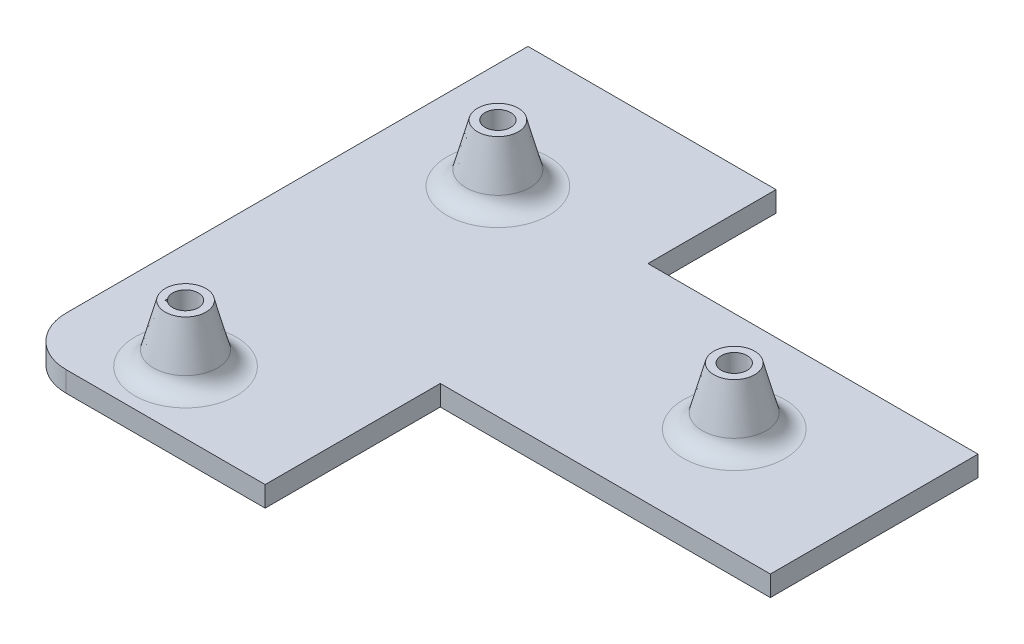
from build123d import *

# Parameters (mm, degrees)
BACKPLANE_EXTRUDE_DEPTH = 3.175
BACKPLANE_FILLETS_R     = 7.62
PROTOBOARD1_R           = 5.5499
PROTOBOARD1_R_2         = 1.9939
BOSS_EXTRUDE2_DEPTH     = 8.89
DRAFT1_ANGLE            = 15
FILLET5_R               = 3.048
PROTOBOARD2_R           = 5.5499
PROTOBOARD2_R_2         = 1.9939
BOSS_EXTRUDE3_DEPTH     = 8.89
DRAFT2_ANGLE            = 15
FILLET6_R               = 3.048
ADS1256_R               = 5.5499
ADS1256_R_2             = 1.9939
BOSS_EXTRUDE4_DEPTH     = 8.89
DRAFT3_ANGLE            = 15
FILLET7_R               = 3.048
F_3V_BUCK_R             = 5.5499
F_3V_BUCK_R_2           = 1.9939
BOSS_EXTRUDE5_DEPTH     = 8.89
DRAFT4_ANGLE            = 15
FILLET8_R               = 3.048
RELAY_R                 = 5.5499
RELAY_R_2               = 1.9939
BOSS_EXTRUDE6_DEPTH     = 8.89
DRAFT5_ANGLE            = 15
FILLET9_R               = 3.048
SERVOBOARD_R            = 5.5499
SERVOBOARD_R_2          = 1.9939
BOSS_EXTRUDE7_DEPTH     = 8.89
DRAFT6_ANGLE            = 15
FILLET10_R              = 3.048
NUCLEO_R                = 5.5499
NUCLEO_R_2              = 1.9939
BOSS_EXTRUDE8_DEPTH     = 8.89
DRAFT7_ANGLE            = 15
FILLET11_R              = 3.048
SKETCH1_OUTSIDE_W       = 276.132
SKETCH1_OUTSIDE_H       = 290.102
SKETCH1_OUTSIDE_W_2     = 99.897700443
SKETCH1_OUTSIDE_H_2     = 83.556409937
CUT_EXTRUDE1_DEPTH      = 9.525
SKETCH2_W               = 61.487179275
SKETCH2_H               = 33.59203724
SKETCH2_H_2             = 38.503153795
CUT_EXTRUDE2_DEPTH      = 9.525


with BuildPart() as part:
    # Backplane → Backplane_Extrude (new body)
    with BuildSketch(Plane(origin=(0, 0, 0), x_dir=(1, 0, 0), z_dir=(0, 1, 0))):
        Polygon((8.255, 87.63), (-80.645, 87.63), (-106.045, 87.63), (-106.045, -113.03), (106.045, -113.03), (106.045, 87.63), (80.645, 87.63), (80.645, 113.03), (8.255, 113.03), align=None)
    extrude(amount=-BACKPLANE_EXTRUDE_DEPTH)

    # Backplane_Fillets
    backplane_fillets_edges = [part.edges().sort_by_distance(p)[0] for p in [
        (106.045, -1.5875, -87.63),
        (80.645, -1.5875, -87.63),
        (80.645, -1.5875, -113.03),
        (-106.045, -1.5875, -87.63),
        (106.045, -1.5875, 113.03),
        (-106.045, -1.5875, 113.03),
        (8.255, -1.5875, -113.03),
        (8.255, -1.5875, -87.63),
    ]]
    fillet(backplane_fillets_edges, radius=BACKPLANE_FILLETS_R)

    # Protoboard1 → Boss-Extrude2 (add)
    # profile 1 of 2: a face of its own
    with BuildSketch(Plane(origin=(0, 0, 0), x_dir=(1, 0, 0), z_dir=(0, 1, 0))):
        with Locations((-94.477155088, 49.182704314)):
            Circle(PROTOBOARD1_R)
        with Locations((-94.477155088, 49.182704314)):
            Circle(PROTOBOARD1_R_2, mode=Mode.SUBTRACT)
    # profile 2 of 2: a face of its own
    with BuildSketch(Plane(origin=(0, 0, 0), x_dir=(1, 0, 0), z_dir=(0, 1, 0))):
        with Locations((55.560644912, 49.182704314)):
            Circle(PROTOBOARD1_R)
        with Locations((55.560644912, 49.182704314)):
            Circle(PROTOBOARD1_R_2, mode=Mode.SUBTRACT)
    extrude(amount=BOSS_EXTRUDE2_DEPTH)

    # Draft1
    draft1_faces = [part.faces().sort_by_distance(p)[0] for p in [
        (50.010744912, 4.445, -49.182704314),
        (-100.027055088, 4.445, -49.182704314),
    ]]
    draft(draft1_faces, Plane.ZX, DRAFT1_ANGLE)

    # Fillet5
    fillet5_edges = [part.edges().sort_by_distance(p)[0] for p in [
        (50.010744912, 0, -49.182704314),
        (-100.027055088, 0, -49.182704314),
    ]]
    fillet(fillet5_edges, radius=FILLET5_R)

    # Protoboard2 → Boss-Extrude3 (add)
    # profile 1 of 2: a face of its own
    with BuildSketch(Plane(origin=(0, 0, 0), x_dir=(1, 0, 0), z_dir=(0, 1, 0))):
        with Locations((-95.3389, -8.255)):
            Circle(PROTOBOARD2_R)
        with Locations((-95.3389, -8.255)):
            Circle(PROTOBOARD2_R_2, mode=Mode.SUBTRACT)
    # profile 2 of 2: a face of its own
    with BuildSketch(Plane(origin=(0, 0, 0), x_dir=(1, 0, 0), z_dir=(0, 1, 0))):
        with Locations((54.6989, -8.255)):
            Circle(PROTOBOARD2_R)
        with Locations((54.6989, -8.255)):
            Circle(PROTOBOARD2_R_2, mode=Mode.SUBTRACT)
    extrude(amount=BOSS_EXTRUDE3_DEPTH)

    # Draft2
    draft2_faces = [part.faces().sort_by_distance(p)[0] for p in [
        (49.149, 4.445, 8.255),
        (-100.8888, 4.445, 8.255),
    ]]
    draft(draft2_faces, Plane.ZX, DRAFT2_ANGLE)

    # Fillet6
    fillet6_edges = [part.edges().sort_by_distance(p)[0] for p in [
        (49.149, 0, 8.255),
        (-100.8888, 0, 8.255),
    ]]
    fillet(fillet6_edges, radius=FILLET6_R)

    # ADS1256 → Boss-Extrude4 (add)
    # profile 1 of 4: a face of its own
    with BuildSketch(Plane(origin=(0, 0, 0), x_dir=(1, 0, 0), z_dir=(0, 1, 0))):
        with Locations((68.129687485, -33.451693835)):
            Circle(ADS1256_R)
        with Locations((68.129687485, -33.451693835)):
            Circle(ADS1256_R_2, mode=Mode.SUBTRACT)
    # profile 2 of 4: a face of its own
    with BuildSketch(Plane(origin=(0, 0, 0), x_dir=(1, 0, 0), z_dir=(0, 1, 0))):
        with Locations((98.609687485, -33.451693835)):
            Circle(ADS1256_R)
        with Locations((98.609687485, -33.451693835)):
            Circle(ADS1256_R_2, mode=Mode.SUBTRACT)
    # profile 3 of 4: a face of its own
    with BuildSketch(Plane(origin=(0, 0, 0), x_dir=(1, 0, 0), z_dir=(0, 1, 0))):
        with Locations((68.129687485, 22.174306165)):
            Circle(ADS1256_R)
        with Locations((68.129687485, 22.174306165)):
            Circle(ADS1256_R_2, mode=Mode.SUBTRACT)
    # profile 4 of 4: a face of its own
    with BuildSketch(Plane(origin=(0, 0, 0), x_dir=(1, 0, 0), z_dir=(0, 1, 0))):
        with Locations((98.609687485, 22.174306165)):
            Circle(ADS1256_R)
        with Locations((98.609687485, 22.174306165)):
            Circle(ADS1256_R_2, mode=Mode.SUBTRACT)
    extrude(amount=BOSS_EXTRUDE4_DEPTH)

    # Draft3
    draft3_faces = [part.faces().sort_by_distance(p)[0] for p in [
        (93.059787485, 4.445, -22.174306165),
        (93.059787485, 4.445, 33.451693835),
        (62.579787485, 4.445, 33.451693835),
        (62.579787485, 4.445, -22.174306165),
    ]]
    draft(draft3_faces, Plane.ZX, DRAFT3_ANGLE)

    # Fillet7
    fillet7_edges = [part.edges().sort_by_distance(p)[0] for p in [
        (93.059787485, 0, 33.451693835),
        (93.059787485, 0, -22.174306165),
        (62.579787485, 0, -22.174306165),
        (62.579787485, 0, 33.451693835),
    ]]
    fillet(fillet7_edges, radius=FILLET7_R)

    # 3V_Buck → Boss-Extrude5 (add)
    with BuildSketch(Plane(origin=(0, 0, 0), x_dir=(1, 0, 0), z_dir=(0, 1, 0))):
        with Locations((88.21146798, 54.766566069)):
            Circle(F_3V_BUCK_R)
        with Locations((88.21146798, 54.766566069)):
            Circle(F_3V_BUCK_R_2, mode=Mode.SUBTRACT)
    extrude(amount=BOSS_EXTRUDE5_DEPTH)

    # Draft4
    draft4_faces = [part.faces().sort_by_distance(p)[0] for p in [
        (82.66156798, 4.445, -54.766566069),
    ]]
    draft(draft4_faces, Plane.ZX, DRAFT4_ANGLE)

    # Fillet8
    fillet8_edges = [part.edges().sort_by_distance(p)[0] for p in [
        (82.66156798, 0, -54.766566069),
    ]]
    fillet(fillet8_edges, radius=FILLET8_R)

    # Relay → Boss-Extrude6 (add)
    # profile 1 of 4: a face of its own
    with BuildSketch(Plane(origin=(0, 0, 0), x_dir=(1, 0, 0), z_dir=(0, 1, 0))):
        with Locations((19.216535219, 84.199904102)):
            Circle(RELAY_R)
        with Locations((19.216535219, 84.199904102)):
            Circle(RELAY_R_2, mode=Mode.SUBTRACT)
    # profile 2 of 4: a face of its own
    with BuildSketch(Plane(origin=(0, 0, 0), x_dir=(1, 0, 0), z_dir=(0, 1, 0))):
        with Locations((63.717335219, 84.199904102)):
            Circle(RELAY_R)
        with Locations((63.717335219, 84.199904102)):
            Circle(RELAY_R_2, mode=Mode.SUBTRACT)
    # profile 3 of 4: a face of its own
    with BuildSketch(Plane(origin=(0, 0, 0), x_dir=(1, 0, 0), z_dir=(0, 1, 0))):
        with Locations((19.216535219, 105.789904102)):
            Circle(RELAY_R)
        with Locations((19.216535219, 105.789904102)):
            Circle(RELAY_R_2, mode=Mode.SUBTRACT)
    # profile 4 of 4: a face of its own
    with BuildSketch(Plane(origin=(0, 0, 0), x_dir=(1, 0, 0), z_dir=(0, 1, 0))):
        with Locations((63.717335219, 105.789904102)):
            Circle(RELAY_R)
        with Locations((63.717335219, 105.789904102)):
            Circle(RELAY_R_2, mode=Mode.SUBTRACT)
    extrude(amount=BOSS_EXTRUDE6_DEPTH)

    # Draft5
    draft5_faces = [part.faces().sort_by_distance(p)[0] for p in [
        (13.666635219, 4.445, -84.199904102),
        (58.167435219, 4.445, -84.199904102),
        (58.167435219, 4.445, -105.789904102),
        (13.666635219, 4.445, -105.789904102),
    ]]
    draft(draft5_faces, Plane.ZX, DRAFT5_ANGLE)

    # Fillet9
    fillet9_edges = [part.edges().sort_by_distance(p)[0] for p in [
        (13.666635219, 0, -84.199904102),
        (58.167435219, 0, -84.199904102),
        (58.167435219, 0, -105.789904102),
        (13.666635219, 0, -105.789904102),
    ]]
    fillet(fillet9_edges, radius=FILLET9_R)

    # ServoBoard → Boss-Extrude7 (add)
    # profile 1 of 3: a face of its own
    with BuildSketch(Plane(origin=(0, 0, 0), x_dir=(1, 0, 0), z_dir=(0, 1, 0))):
        with Locations((-89.601054156, -103.3389565)):
            Circle(SERVOBOARD_R)
        with BuildLine():
            ThreePointArc((-91.188554156, -104.545389657), (-88.191153945, -101.929056289), (-90.807487312, -104.9264565))
            Line((-90.807487312, -104.9264565), (-91.188554156, -104.9264565))
            Line((-91.188554156, -104.9264565), (-91.188554156, -104.545389657))
        make_face(mode=Mode.SUBTRACT)
    # profile 2 of 3: a face of its own
    with BuildSketch(Plane(origin=(0, 0, 0), x_dir=(1, 0, 0), z_dir=(0, 1, 0))):
        with Locations((-89.601054156, -54.8757565)):
            Circle(SERVOBOARD_R)
        with Locations((-89.601054156, -54.8757565)):
            Circle(SERVOBOARD_R_2, mode=Mode.SUBTRACT)
    # profile 3 of 3: a face of its own
    with BuildSketch(Plane(origin=(0, 0, 0), x_dir=(1, 0, 0), z_dir=(0, 1, 0))):
        with Locations((-38.613679755, -69.190417722)):
            Circle(SERVOBOARD_R)
        with Locations((-38.613679755, -69.190417722)):
            Circle(SERVOBOARD_R_2, mode=Mode.SUBTRACT)
    extrude(amount=BOSS_EXTRUDE7_DEPTH)

    # Draft6
    draft6_faces = [part.faces().sort_by_distance(p)[0] for p in [
        (-95.150954156, 4.445, 54.8757565),
        (-44.163579755, 4.445, 69.190417722),
        (-95.150954156, 4.445, 103.3389565),
    ]]
    draft(draft6_faces, Plane.ZX, DRAFT6_ANGLE)

    # Fillet10
    fillet10_edges = [part.edges().sort_by_distance(p)[0] for p in [
        (-95.150954156, 0, 103.3389565),
        (-44.163579755, 0, 69.190417722),
        (-95.150954156, 0, 54.8757565),
    ]]
    fillet(fillet10_edges, radius=FILLET10_R)

    # Nucleo → Boss-Extrude8 (add)
    # profile 1 of 4: a face of its own
    with BuildSketch(Plane(origin=(0, 0, 0), x_dir=(1, 0, 0), z_dir=(0, 1, 0))):
        with Locations((73.719801758, -98.03908452)):
            Circle(NUCLEO_R)
        with BuildLine():
            Line((75.307301758, -99.245517676), (75.307301758, -99.62658452))
            Line((75.307301758, -99.62658452), (74.926234914, -99.62658452))
            ThreePointArc((74.926234914, -99.62658452), (72.309901547, -96.629184309), (75.307301758, -99.245517676))
        make_face(mode=Mode.SUBTRACT)
    # profile 2 of 4: a face of its own
    with BuildSketch(Plane(origin=(0, 0, 0), x_dir=(1, 0, 0), z_dir=(0, 1, 0))):
        with Locations((73.719801758, -49.77908452)):
            Circle(NUCLEO_R)
        with Locations((73.719801758, -49.77908452)):
            Circle(NUCLEO_R_2, mode=Mode.SUBTRACT)
    # profile 3 of 4: a face of its own
    with BuildSketch(Plane(origin=(0, 0, 0), x_dir=(1, 0, 0), z_dir=(0, 1, 0))):
        with Locations((-1.270198122, -51.04908452)):
            Circle(NUCLEO_R)
        with Locations((-1.270198122, -51.04908452)):
            Circle(NUCLEO_R_2, mode=Mode.SUBTRACT)
    # profile 4 of 4: a face of its own
    with BuildSketch(Plane(origin=(0, 0, 0), x_dir=(1, 0, 0), z_dir=(0, 1, 0))):
        with Locations((-1.270198122, -96.76908452)):
            Circle(NUCLEO_R)
        with Locations((-1.270198122, -96.76908452)):
            Circle(NUCLEO_R_2, mode=Mode.SUBTRACT)
    extrude(amount=BOSS_EXTRUDE8_DEPTH)

    # Draft7
    draft7_faces = [part.faces().sort_by_distance(p)[0] for p in [
        (68.169901758, 4.445, 98.03908452),
        (68.169901758, 4.445, 49.77908452),
        (-6.820098122, 4.445, 51.04908452),
        (-6.820098122, 4.445, 96.76908452),
    ]]
    draft(draft7_faces, Plane.ZX, DRAFT7_ANGLE)

    # Fillet11
    fillet11_edges = [part.edges().sort_by_distance(p)[0] for p in [
        (68.169901758, 0, 98.03908452),
        (68.169901758, 0, 49.77908452),
        (-6.820098122, 0, 51.04908452),
        (-6.820098122, 0, 96.76908452),
    ]]
    fillet(fillet11_edges, radius=FILLET11_R)

    # Sketch1 outside → Cut-Extrude1 (cut, symmetric)
    with BuildSketch(Plane(origin=(0, 0, 0), x_dir=(1, 0, 0), z_dir=(0, 1, 0))):
        Rectangle(SKETCH1_OUTSIDE_W, SKETCH1_OUTSIDE_H)
        with Locations((-66.290140726, -75.539927804)):
            Rectangle(SKETCH1_OUTSIDE_W_2, SKETCH1_OUTSIDE_H_2, mode=Mode.SUBTRACT)
    extrude(amount=CUT_EXTRUDE1_DEPTH, both=True, mode=Mode.SUBTRACT)

    # Sketch2 → Cut-Extrude2 (cut, symmetric)
    with BuildSketch(Plane(origin=(0, 0, 0), x_dir=(1, 0, 0), z_dir=(0, 1, 0))):
        with Locations((-36.812077345, -102.652976529)):
            Rectangle(SKETCH2_W, SKETCH2_H)
        with Locations((-36.812077345, -34.388456408)):
            Rectangle(SKETCH2_W, SKETCH2_H_2)
    extrude(amount=CUT_EXTRUDE2_DEPTH, both=True, mode=Mode.SUBTRACT)


solid = part.part
